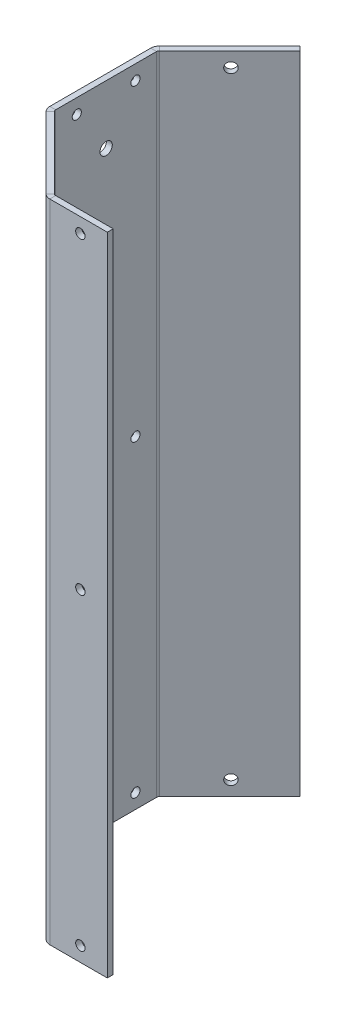
from build123d import *
from build123d.topology import SkipClean

# Parameters (mm, degrees)
EXTRUDE_1_DEPTH             = 220
SKETCH_3_R                  = 1.55
SKETCH_3_R_2                = 2.1
CUT_EXTRUDE_1_DEPTH         = 10
SKETCH_6_R                  = 1.6
CUT_EXTRUDE_2_DEPTH         = 10
CHAMFER_1_SIZE              = 1
CHAMFER_1_SIZE2             = 0.707106781
SHEET_START                 = -114.419250373
SHEET_METAL_2_OUTLINE_W     = 220
SHEET_METAL_2_OUTLINE_H     = 86.5
SHEET_METAL_2_OUTLINE_R     = 1.55
SHEET_METAL_2_OUTLINE_R_2   = 2.1
SHEET_METAL_2_DEPTH         = 26.274603255
SHEET_START_2               = -87.816219993
SHEET_METAL_2_2_OUTLINE_W   = 220
SHEET_METAL_2_2_OUTLINE_H   = 87
SHEET_METAL_2_2_OUTLINE_R   = 1.55
SHEET_METAL_2_2_OUTLINE_R_2 = 2.1
SHEET_METAL_2_2_DEPTH       = 0.483052927
SHEET_START_3               = -89.230433555
SHEET_METAL_2_3_OUTLINE_W   = 220
SHEET_METAL_2_3_OUTLINE_H   = 0.5
SHEET_METAL_2_3_DEPTH       = 21.707106781
SHEET_METAL_2_4_DEPTH       = 220
SHEET_METAL_2_5_DEPTH       = 220
SHEET_START_4               = 44
SHEET_METAL_2_6_OUTLINE_R   = 1.6
SHEET_METAL_2_6_DEPTH       = 0.5
SKETCH_7_R                  = 1.75
CUT_EXTRUDE_3_DEPTH         = 10


with BuildPart() as part:
    # 草图2 → 凸台-拉伸1 (new body)
    with BuildSketch(Plane(origin=(0, 0, 0), x_dir=(1, 0, 0), z_dir=(0, 1, 0))):
        Polygon((-87.523326774, 42.5), (-112.419250373, 17.604076401), (-112.419250373, -17.604076401), (-87.523326774, -42.5), (-67.523326774, -42.5), (-67.523326774, -44), (-88.144647118, -44), (-113.919250373, -18.225396744), (-113.919250373, 18.225396744), (-89.644647118, 42.5), align=None)
    extrude(amount=EXTRUDE_1_DEPTH)

    # Sketch 3 → 切除-拉伸1 (cut)
    with BuildSketch(Plane.ZY.offset(113.919250373)):
        with Locations((-10, 5)):
            Circle(SKETCH_3_R)
        with Locations((10, 5)):
            Circle(SKETCH_3_R)
        with BuildLine():
            ThreePointArc((-8.45, 110), (-10, 111.55), (-11.55, 110))
            Line((-11.55, 110), (-8.45, 110))
        make_face()
        with BuildLine():
            Line((-8.45, 110), (-11.55, 110))
            ThreePointArc((-11.55, 110), (-10, 108.45), (-8.45, 110))
        make_face()
        with BuildLine():
            ThreePointArc((8.45, 110), (10, 108.45), (11.55, 110))
            Line((11.55, 110), (8.45, 110))
        make_face()
        with BuildLine():
            Line((8.45, 110), (11.55, 110))
            ThreePointArc((11.55, 110), (10, 111.55), (8.45, 110))
        make_face()
        with Locations((-10, 215)):
            Circle(SKETCH_3_R)
        with Locations((10, 215)):
            Circle(SKETCH_3_R)
        with Locations((0, 200)):
            Circle(SKETCH_3_R_2)
        with Locations((0, 165)):
            Circle(SKETCH_3_R_2)
        with Locations((0, 55)):
            Circle(SKETCH_3_R_2)
        with Locations((0, 20)):
            Circle(SKETCH_3_R_2)
    extrude(amount=-CUT_EXTRUDE_1_DEPTH, mode=Mode.SUBTRACT)

    # 草图6 → 切除-拉伸2 (cut)
    with BuildSketch(Plane.XY.offset(44)):
        with Locations((-76.693326774, 5)):
            Circle(SKETCH_6_R)
        with Locations((-76.693326774, 110)):
            Circle(SKETCH_6_R)
        with Locations((-76.693326774, 215)):
            Circle(SKETCH_6_R)
    extrude(amount=-CUT_EXTRUDE_2_DEPTH, mode=Mode.SUBTRACT)

    # 倒角1
    chamfer_1_edges = [part.edges().sort_by_distance(p)[0] for p in [
        (-87.523326774, 110, -42.5),
    ]]
    chamfer_1_side = [part.faces().sort_by_distance(p)[0] for p in [
        (-99.971288574, 110, -30.0520382),
    ]]
    chamfer(chamfer_1_edges, length=CHAMFER_1_SIZE, length2=CHAMFER_1_SIZE2, reference=chamfer_1_side[0])

    # Sheet Metal 2: read off the stored shape, not the designer's step
    # Sheet Metal 2 outline → Sheet Metal 2 (add)
    with SkipClean():  # the faces are left unmerged after this step: merging them gives an invalid solid
        with BuildSketch(Plane.YZ.offset(SHEET_START)):
            with Locations((110, 0.75)):
                Rectangle(SHEET_METAL_2_OUTLINE_W, SHEET_METAL_2_OUTLINE_H)
            with Locations((5, -10)):
                Circle(SHEET_METAL_2_OUTLINE_R, mode=Mode.SUBTRACT)
            with Locations((20, 0)):
                Circle(SHEET_METAL_2_OUTLINE_R_2, mode=Mode.SUBTRACT)
            with Locations((55, 0)):
                Circle(SHEET_METAL_2_OUTLINE_R_2, mode=Mode.SUBTRACT)
            with Locations((110, -10)):
                Circle(SHEET_METAL_2_OUTLINE_R, mode=Mode.SUBTRACT)
            with Locations((215, -10)):
                Circle(SHEET_METAL_2_OUTLINE_R, mode=Mode.SUBTRACT)
            with Locations((165, 0)):
                Circle(SHEET_METAL_2_OUTLINE_R_2, mode=Mode.SUBTRACT)
            with Locations((200, 0)):
                Circle(SHEET_METAL_2_OUTLINE_R_2, mode=Mode.SUBTRACT)
            with Locations((5, 10)):
                Circle(SHEET_METAL_2_OUTLINE_R, mode=Mode.SUBTRACT)
            with Locations((110, 10)):
                Circle(SHEET_METAL_2_OUTLINE_R, mode=Mode.SUBTRACT)
            with Locations((215, 10)):
                Circle(SHEET_METAL_2_OUTLINE_R, mode=Mode.SUBTRACT)
        extrude(amount=SHEET_METAL_2_DEPTH)

    # Sheet Metal 2 2 outline → Sheet Metal 2 2 (add)
    with SkipClean():  # the faces are left unmerged after this step: merging them gives an invalid solid
        with BuildSketch(Plane.YZ.offset(SHEET_START_2)):
            with Locations((110, 1)):
                Rectangle(SHEET_METAL_2_2_OUTLINE_W, SHEET_METAL_2_2_OUTLINE_H)
            with Locations((5, -10)):
                Circle(SHEET_METAL_2_2_OUTLINE_R, mode=Mode.SUBTRACT)
            with Locations((20, 0)):
                Circle(SHEET_METAL_2_2_OUTLINE_R_2, mode=Mode.SUBTRACT)
            with Locations((55, 0)):
                Circle(SHEET_METAL_2_2_OUTLINE_R_2, mode=Mode.SUBTRACT)
            with Locations((110, -10)):
                Circle(SHEET_METAL_2_2_OUTLINE_R, mode=Mode.SUBTRACT)
            with Locations((215, -10)):
                Circle(SHEET_METAL_2_2_OUTLINE_R, mode=Mode.SUBTRACT)
            with Locations((165, 0)):
                Circle(SHEET_METAL_2_2_OUTLINE_R_2, mode=Mode.SUBTRACT)
            with Locations((200, 0)):
                Circle(SHEET_METAL_2_2_OUTLINE_R_2, mode=Mode.SUBTRACT)
            with Locations((5, 10)):
                Circle(SHEET_METAL_2_2_OUTLINE_R, mode=Mode.SUBTRACT)
            with Locations((110, 10)):
                Circle(SHEET_METAL_2_2_OUTLINE_R, mode=Mode.SUBTRACT)
            with Locations((215, 10)):
                Circle(SHEET_METAL_2_2_OUTLINE_R, mode=Mode.SUBTRACT)
        extrude(amount=SHEET_METAL_2_2_DEPTH)

    # Sheet Metal 2 3 outline → Sheet Metal 2 3 (add)
    with SkipClean():  # the faces are left unmerged after this step: merging them gives an invalid solid
        with BuildSketch(Plane.YZ.offset(SHEET_START_3)):
            with Locations((110, 44.25)):
                Rectangle(SHEET_METAL_2_3_OUTLINE_W, SHEET_METAL_2_3_OUTLINE_H)
        extrude(amount=SHEET_METAL_2_3_DEPTH)

    # Sheet Metal 2 4 outline → Sheet Metal 2 4 (cut)
    with BuildSketch(Plane(origin=(0, 0, 0), x_dir=(1, 0, 0), z_dir=(0, 1, 0))):
        with BuildLine():
            Line((-87.816219993, 42.5), (-87.816219993, -42.207106781))
            ThreePointArc((-87.816219993, -42.207106781), (-87.593520149, -42.374842797), (-87.333167066, -42.474576765))
            Line((-87.333167066, -42.474576765), (-87.333167066, 42.5))
            Line((-87.333167066, 42.5), (-87.816219993, 42.5))
        make_face()
        with BuildLine():
            Line((-88.144647118, 42.5), (-88.937540337, 42.5))
            Line((-88.937540337, 42.5), (-88.230433555, 41.792893219))
            Line((-88.230433555, 41.792893219), (-112.126357154, 17.89696962))
            ThreePointArc((-112.126357154, 17.89696962), (-112.343129906, 17.572546271), (-112.419250373, 17.189862838))
            Line((-112.419250373, 17.189862838), (-112.419250373, -17.189862838))
            ThreePointArc((-112.419250373, -17.189862838), (-112.343129906, -17.572546271), (-112.126357154, -17.89696962))
            Line((-112.126357154, -17.89696962), (-88.144647118, -41.878679656))
            Line((-88.144647118, -41.878679656), (-88.144647118, 42.5))
        make_face()
        with BuildLine():
            ThreePointArc((-113.540570717, -19.311183182), (-114.190888971, -18.337913135), (-114.419250373, -17.189862838))
            Line((-114.419250373, -17.189862838), (-114.419250373, -44))
            Line((-114.419250373, -44), (-89.230433555, -44))
            Line((-89.230433555, -44), (-89.230433555, -44.5))
            Line((-89.230433555, -44.5), (-87.109113212, -44.5))
            ThreePointArc((-87.109113212, -44.5), (-88.257163509, -44.271638598), (-89.230433555, -43.621320344))
            Line((-89.230433555, -43.621320344), (-113.540570717, -19.311183182))
        make_face()
        with BuildLine():
            Line((-113.540570717, 19.311183182), (-90.351753899, 42.5))
            Line((-90.351753899, 42.5), (-114.419250373, 42.5))
            Line((-114.419250373, 42.5), (-114.419250373, 17.189862838))
            ThreePointArc((-114.419250373, 17.189862838), (-114.190888971, 18.337913135), (-113.540570717, 19.311183182))
        make_face()
    extrude(amount=SHEET_METAL_2_4_DEPTH, mode=Mode.SUBTRACT)

    # Sheet Metal 2 5 outline → Sheet Metal 2 5 (add)
    with BuildSketch(Plane(origin=(0, 0, 0), x_dir=(1, 0, 0), z_dir=(0, 1, 0))):
        with BuildLine():
            ThreePointArc((-87.109113212, -42.5), (-87.221859022, -42.493623864), (-87.333167066, -42.474576765))
            Line((-87.333167066, -42.474576765), (-87.333167066, -42.5))
            Line((-87.333167066, -42.5), (-87.109113212, -42.5))
        make_face()
        Polygon((-88.937540337, 42.5), (-89.644647118, 43.207106781), (-90.351753899, 42.5), align=None)
    extrude(amount=SHEET_METAL_2_5_DEPTH)

    # Sheet Metal 2 6 outline → Sheet Metal 2 6 (cut)
    with BuildSketch(Plane.XY.offset(SHEET_START_4)):
        with Locations((-76.693326774, 5)):
            Circle(SHEET_METAL_2_6_OUTLINE_R)
        with Locations((-76.693326774, 110)):
            Circle(SHEET_METAL_2_6_OUTLINE_R)
        with Locations((-76.693326774, 215)):
            Circle(SHEET_METAL_2_6_OUTLINE_R)
    extrude(amount=SHEET_METAL_2_6_DEPTH, mode=Mode.SUBTRACT)

    # 草图7 → 切除-拉伸3 (cut)
    with BuildSketch(Plane(origin=(-66.425876949, 0, -66.425876949), x_dir=(-0.7071067811865474, 0, 0.7071067811865477), z_dir=(-0.7071067811865477, 0, -0.7071067811865474))):
        with Locations((49.436299673, 215)):
            Circle(SKETCH_7_R)
        with Locations((49.436299673, 5)):
            Circle(SKETCH_7_R)
    extrude(amount=-CUT_EXTRUDE_3_DEPTH, mode=Mode.SUBTRACT)


solid = part.part
